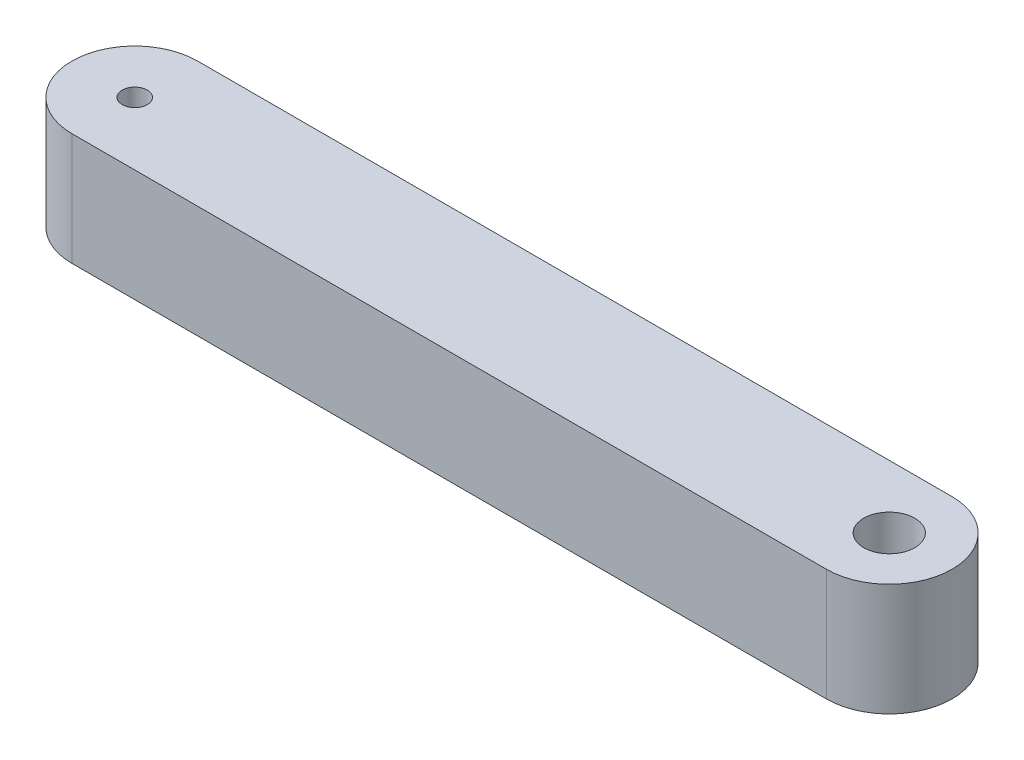
from build123d import *

# Parameters (mm, degrees)
SKETCH1_R           = 3
BOSS_EXTRUDE2_DEPTH = 26.8
SKETCH2_R           = 6.1
CUT_EXTRUDE1_DEPTH  = 26.8
SKETCH3_R           = 6.5
CUT_EXTRUDE2_DEPTH  = 5


with BuildPart() as part:
    # Sketch1 → Boss-Extrude2 (new body)
    with BuildSketch(Plane(origin=(0, 0, 0), x_dir=(1, 0, 0), z_dir=(0, 1, 0))):
        with BuildLine():
            Line((-90, -15), (90, -15))
            ThreePointArc((90, -15), (105, 0), (90, 15))
            Line((90, 15), (-90, 15))
            ThreePointArc((-90, 15), (-105, 0), (-90, -15))
        make_face()
        with Locations((-90, 0)):
            Circle(SKETCH1_R, mode=Mode.SUBTRACT)
        with Locations((90, 0)):
            Circle(SKETCH1_R, mode=Mode.SUBTRACT)
    extrude(amount=BOSS_EXTRUDE2_DEPTH)

    # Sketch2 → Cut-Extrude1 (cut)
    with BuildSketch(Plane.XZ):
        with Locations((90, 0)):
            Circle(SKETCH2_R)
    extrude(amount=-CUT_EXTRUDE1_DEPTH, mode=Mode.SUBTRACT)

    # Sketch3 → Cut-Extrude2 (cut)
    with BuildSketch(Plane.XZ):
        with Locations((90, 0)):
            Circle(SKETCH3_R)
    extrude(amount=-CUT_EXTRUDE2_DEPTH, mode=Mode.SUBTRACT)


solid = part.part
